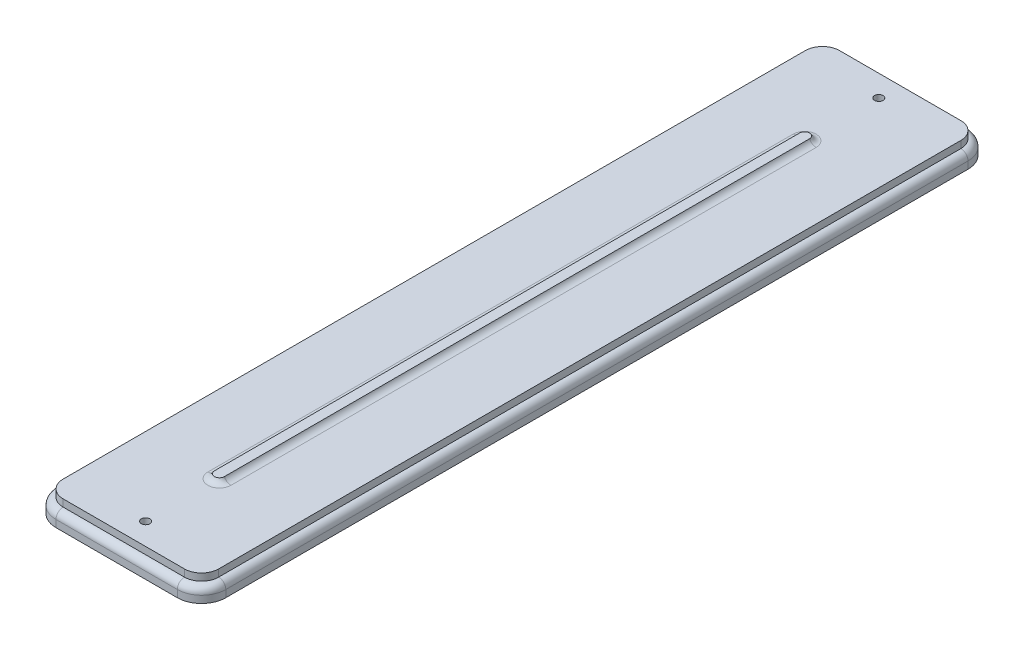
from build123d import *

# Parameters (mm, degrees)
SKETCH3_R           = 3
BOSS_EXTRUDE3_DEPTH = 5
BOSS_EXTRUDE4_DEPTH = 3
FILLET5_R           = 5
BOSS_EXTRUDE5_DEPTH = 10
FILLET7_R           = 5


# Some blends are built 0.0001 mm under size
with BuildPart() as part:
    # Sketch3 → Boss-Extrude3 (new body)
    with BuildSketch(Plane(origin=(0, 0, 0), x_dir=(1, 0, 0), z_dir=(0, 1, 0))):
        with BuildLine():
            Line((-42.5, 272), (42.5, 272))
            ThreePointArc((42.5, 272), (50.985281374, 268.485281374), (54.5, 260))
            Line((54.5, 260), (54.5, -260))
            ThreePointArc((54.5, -260), (50.985281374, -268.485281374), (42.5, -272))
            Line((42.5, -272), (-42.5, -272))
            ThreePointArc((-42.5, -272), (-50.985281374, -268.485281374), (-54.5, -260))
            Line((-54.5, -260), (-54.5, 260))
            ThreePointArc((-54.5, 260), (-50.985281374, 268.485281374), (-42.5, 272))
        make_face()
        with Locations(Location((0, 257, 0), (0, 0, 270))):
            Circle(SKETCH3_R, mode=Mode.SUBTRACT)
        with Locations(Location((0, -256.72, 0), (0, 0, 270))):
            Circle(SKETCH3_R, mode=Mode.SUBTRACT)
    extrude(amount=-BOSS_EXTRUDE3_DEPTH)

    # Sketch4 → Boss-Extrude4 (add)
    with BuildSketch(Plane(origin=(0, 0, 0), x_dir=(1, 0, 0), z_dir=(0, 1, 0))):
        with BuildLine():
            Line((-3.5, 205), (-3.5, -205))
            ThreePointArc((-3.5, -205), (0, -208.5), (3.5, -205))
            Line((3.5, -205), (3.5, 205))
            ThreePointArc((3.5, 205), (0, 208.5), (-3.5, 205))
        make_face()
    extrude(amount=BOSS_EXTRUDE4_DEPTH)

    # Fillet5
    # the kernel refuses this fillet: 5 mm, written as the material it adds along each edge
    with BuildSketch(Plane(origin=(0, 0, 205), x_dir=(-1, 0, 0), z_dir=(0, 0, -1))) as fillet5_piece_1:
        with BuildLine():
            CenterArc((8.082575695, 5), FILLET5_R, 203.578178478, 66.421821522)
            Line((3.5, 3), (3.408348486, 2.96))
            ThreePointArc((3.408348486, 2.96), (3.4, 1.5), (3.4, 0))
            Line((3.4, 0), (3.5, -0.1))
            Line((3.5, -0.1), (8.082575695, -0.1))
            Line((8.082575695, -0.1), (8.082575695, 0))
        make_face()
    revolve(axis=Axis((0, 0, 205), (0, 1, 0)), revolution_arc=180)
    with BuildSketch(Plane(origin=(-3.5, 0, -205), x_dir=(-1, 0, 0), z_dir=(0, 0, 1)), Plane(origin=(3.5, 0, 205), x_dir=(1, 0, 0), z_dir=(0, 0, -1))) as fillet5_piece_2:
        with BuildLine():
            CenterArc((4.582575695, -5), FILLET5_R, 90, 66.421821522)
            Line((0, -3), (-0.091651514, -2.96))
            ThreePointArc((-0.091651514, -2.96), (-0.1, -1.5), (-0.1, 0))
            Line((-0.1, 0), (0, 0.1))
            Line((0, 0.1), (4.582575695, 0.1))
            Line((4.582575695, 0.1), (4.582575695, 0))
        make_face()
    extrude(amount=410)
    with BuildSketch(Plane(origin=(0, 0, -205), x_dir=(1, 0, 0), z_dir=(0, 0, 1))) as fillet5_piece_3:
        with BuildLine():
            CenterArc((8.082575695, 5), FILLET5_R, 203.578178478, 66.421821522)
            Line((3.5, 3), (3.408348486, 2.96))
            ThreePointArc((3.408348486, 2.96), (3.4, 1.5), (3.4, 0))
            Line((3.4, 0), (3.5, -0.1))
            Line((3.5, -0.1), (8.082575695, -0.1))
            Line((8.082575695, -0.1), (8.082575695, 0))
        make_face()
    revolve(axis=Axis((0, 0, -205), (0, 1, 0)), revolution_arc=180)


with BuildPart() as body_2:
    # Sketch5 → Boss-Extrude5 (new body)
    with BuildSketch(Plane.XZ.offset(5)):
        with BuildLine():
            Line((-42.5, 277), (42.5, 277))
            ThreePointArc((42.5, 277), (54.52081528, 272.02081528), (59.5, 260))
            Line((59.5, 260), (59.5, -260))
            ThreePointArc((59.5, -260), (54.52081528, -272.02081528), (42.5, -277))
            Line((42.5, -277), (-42.5, -277))
            ThreePointArc((-42.5, -277), (-54.52081528, -272.02081528), (-59.5, -260))
            Line((-59.5, -260), (-59.5, 260))
            ThreePointArc((-59.5, 260), (-54.52081528, 272.02081528), (-42.5, 277))
        make_face()
        with BuildLine():
            Line((-54.5, 260), (-54.5, -260))
            ThreePointArc((-54.5, -260), (-50.985281374, -268.485281374), (-42.5, -272))
            Line((-42.5, -272), (42.5, -272))
            ThreePointArc((42.5, -272), (50.985281374, -268.485281374), (54.5, -260))
            Line((54.5, -260), (54.5, 260))
            ThreePointArc((54.5, 260), (50.985281374, 268.485281374), (42.5, 272))
            Line((42.5, 272), (-42.5, 272))
            ThreePointArc((-42.5, 272), (-50.985281374, 268.485281374), (-54.5, 260))
        make_face(mode=Mode.SUBTRACT)
    extrude(amount=BOSS_EXTRUDE5_DEPTH)

    # Fillet7
    fillet7_edges = [body_2.edges().sort_by_distance(p)[0] for p in [
        (0, -5, -277),
        (-54.52081528, -5, -272.02081528),
        (-59.5, -5, 0),
        (-54.52081528, -5, 272.02081528),
        (0, -5, 277),
        (54.52081528, -5, 272.02081528),
        (59.5, -5, 0),
        (54.52081528, -5, -272.02081528),
    ]]
    fillet(fillet7_edges, radius=FILLET7_R - 0.0001)  # a hair under: the kernel refuses the full size


solid = Compound([part.part, body_2.part])
